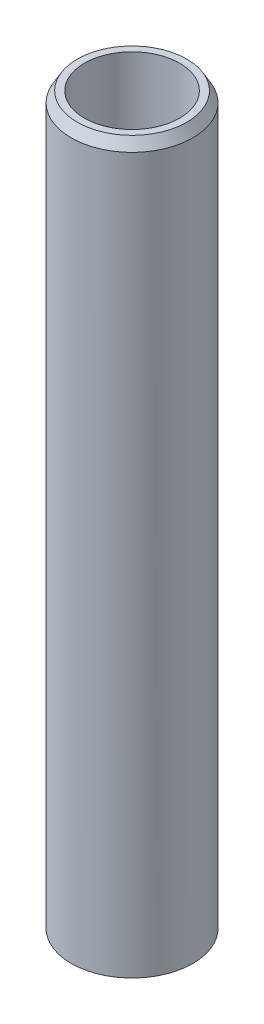
from build123d import *
from OCP.BRepFilletAPI import BRepFilletAPI_MakeChamfer

# Parameters (mm, degrees)
SKETCH1_R           = 25
BOSS_EXTRUDE1_DEPTH = 300.748974997
SKETCH2_R           = 19.584273175
CUT_EXTRUDE1_DEPTH  = 303.819989369
CHAMFER1_SIZE       = 4.314246329
CHAMFER1_SIZE2      = 2.490831279


with BuildPart() as part:
    # Sketch1 → Boss-Extrude1 (new body)
    with BuildSketch(Plane(origin=(0, 0, 0), x_dir=(1, 0, 0), z_dir=(0, 1, 0))):
        Circle(SKETCH1_R)
    extrude(amount=BOSS_EXTRUDE1_DEPTH)

    # Sketch2 → Cut-Extrude1 (cut, through all)
    with BuildSketch(Plane(origin=(0, 0, 0), x_dir=(1, 0, 0), z_dir=(0, 1, 0))):
        Circle(SKETCH2_R)
    extrude(amount=CUT_EXTRUDE1_DEPTH, mode=Mode.SUBTRACT)

    # Chamfer1: one chamfer whose edges measure the first distance from different faces: ONE call of the kernel's chamfer builder (chamfer() names one face for all edges)
    chamfer1_edges_1 = [part.edges().sort_by_distance(p)[0] for p in [
        (-25, 300.748974997, 0),
    ]]
    chamfer1_side_1 = [part.faces().sort_by_distance(p)[0] for p in [
        (-25, 150.374487498, 0),
    ]]
    chamfer1_edges_2 = [part.edges().sort_by_distance(p)[0] for p in [
        (-25, 0, 0),
    ]]
    chamfer1_side_2 = [part.faces().sort_by_distance(p)[0] for p in [
        (-24.292893219, 0, 0),
    ]]
    chamfer1 = BRepFilletAPI_MakeChamfer(part.part.solid().wrapped)
    for e in chamfer1_edges_1:
        chamfer1.Add(CHAMFER1_SIZE, CHAMFER1_SIZE2, e.wrapped, chamfer1_side_1[0].wrapped)  # the first distance lies on this face
    for e in chamfer1_edges_2:
        chamfer1.Add(CHAMFER1_SIZE, CHAMFER1_SIZE2, e.wrapped, chamfer1_side_2[0].wrapped)  # the first distance lies on this face
    add(Compound.cast(chamfer1.Shape()), mode=Mode.REPLACE)


solid = part.part
